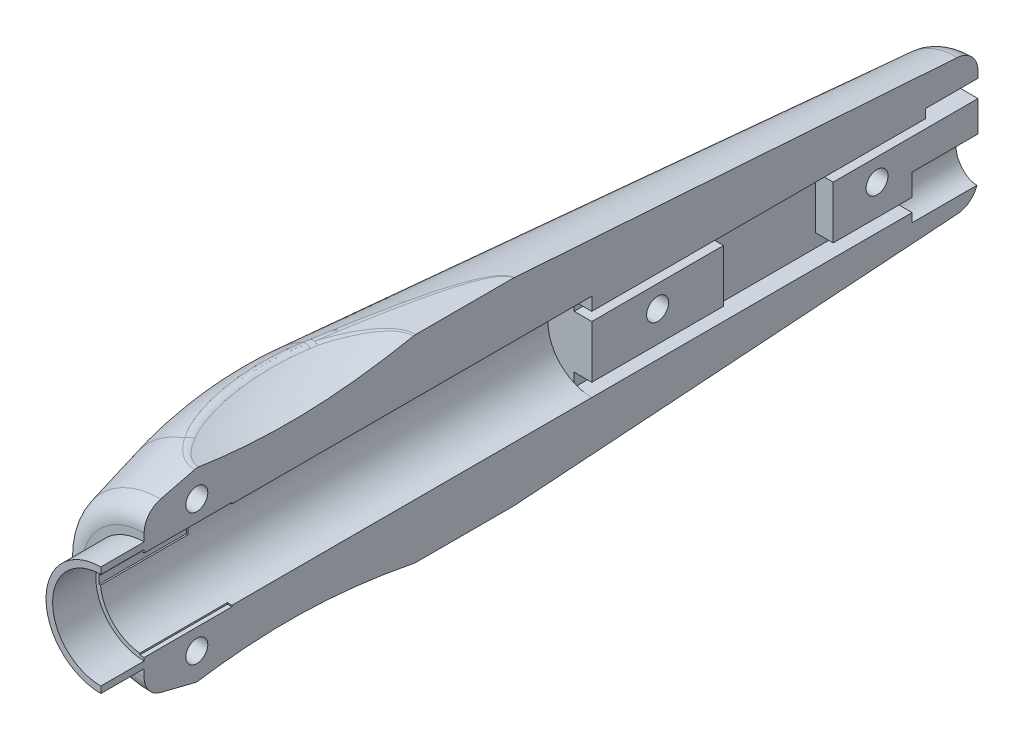
from build123d import *

# Parameters (mm, degrees)
BOSS_EXTRUDE1_DEPTH      = 51
BOSS_EXTRUDE1_DEPTH_BACK = 35
SKETCH1_R                = 11.25
SKETCH1_R_2              = 5
SKETCH2_R                = 11.25
BOSS_EXTRUDE2_DEPTH      = 9
CUT_EXTRUDE1_DEPTH       = 6
CUT_EXTRUDE2_START       = -2.5
SKETCH4_W                = 10
SKETCH4_H                = 2.5
CUT_EXTRUDE2_DEPTH       = 5
SKETCH5_R                = 2.5
CUT_EXTRUDE3_DEPTH       = 7.5
SKETCH6_W                = 1
SKETCH6_H                = 0.25
SKETCH6_W_2              = 0.25
SKETCH6_H_2              = 1
CUT_EXTRUDE4_DEPTH       = 10
SKETCH7_W                = 22.5
SKETCH7_H                = 22.5
SKETCH7_R                = 7.5
BOSS_EXTRUDE3_DEPTH      = 55
SKETCH11_R               = 6.25
SKETCH11_R_2             = 5.5
BOSS_EXTRUDE4_DEPTH      = 5
SKETCH14_W               = 14.477531198
SKETCH14_H               = 32.54061919
CUT_EXTRUDE5_DEPTH       = 30
CIRPATTERN1_COUNT        = 4
FILLET3_R                = 1.25
FILLET6_R                = 2.5
FILLET7_R                = 50
FILLET8_R                = 2.5
FILLET9_R                = 1.25
SKETCH18_R               = 5
BOSS_EXTRUDE5_DEPTH      = 35
CUT_EXTRUDE6_DEPTH       = 86
CUT_EXTRUDE6_DEPTH_BACK  = 64
SKETCH19_W               = 22.75138552
SKETCH19_H               = 48.207966269
CUT_EXTRUDE8_DEPTH       = 2
SKETCH21_R               = 1.25
CUT_EXTRUDE9_DEPTH       = 3


with BuildPart() as part:
    # Sketch1 → Boss-Extrude1 (new, two sides: drawn at the far end of the back side and taken through both)
    with BuildSketch(Plane.XY.offset(-BOSS_EXTRUDE1_DEPTH_BACK)):
        Circle(SKETCH1_R)
        Circle(SKETCH1_R_2, mode=Mode.SUBTRACT)
    extrude(amount=BOSS_EXTRUDE1_DEPTH + BOSS_EXTRUDE1_DEPTH_BACK)

    # Sketch2 → Boss-Extrude2 (add)
    with BuildSketch(Plane(origin=(0, 0, -35), x_dir=(-1, 0, 0), z_dir=(0, 0, -1))):
        with Locations(Location((0, 0, 0), (0, 0, 180))):
            Circle(SKETCH2_R)
    extrude(amount=BOSS_EXTRUDE2_DEPTH)

    # Sketch3 → Cut-Extrude1 (cut)
    with BuildSketch(Plane(origin=(0, 0, -44), x_dir=(-1, 0, 0), z_dir=(0, 0, -1))):
        Polygon((-2, 4.5), (-3, 3.5), (-3, 2.5), (3, 2.5), (3, 3.5), (2, 4.5), align=None)
    extrude(amount=-CUT_EXTRUDE1_DEPTH, mode=Mode.SUBTRACT)

    # Sketch4 → Cut-Extrude2 (cut)
    with BuildSketch(Plane(origin=(0, 0, -44), x_dir=(-1, 0, 0), z_dir=(0, 0, -1)).offset(CUT_EXTRUDE2_START)):
        with Locations((0, -2.25)):
            Rectangle(SKETCH4_W, SKETCH4_H)
    extrude(amount=-CUT_EXTRUDE2_DEPTH, mode=Mode.SUBTRACT)

    # Sketch5 → Cut-Extrude3 (cut)
    with BuildSketch(Plane(origin=(0, 0, -44), x_dir=(-1, 0, 0), z_dir=(0, 0, -1))):
        with Locations((0, -3.5)):
            Circle(SKETCH5_R)
    extrude(amount=-CUT_EXTRUDE3_DEPTH, mode=Mode.SUBTRACT)

    # Sketch6 → Cut-Extrude4 (cut)
    with BuildSketch(Plane.XY.offset(51)):
        with Locations((0, 5.025)):
            Rectangle(SKETCH6_W, SKETCH6_H)
        with Locations((-5.025, 0)):
            Rectangle(SKETCH6_W_2, SKETCH6_H_2)
        with Locations((5.025, 0)):
            Rectangle(SKETCH6_W_2, SKETCH6_H_2)
        with Locations((0, -5.025)):
            Rectangle(SKETCH6_W, SKETCH6_H)
    extrude(amount=-CUT_EXTRUDE4_DEPTH, mode=Mode.SUBTRACT)

    # Sketch7 → Boss-Extrude3 (add)
    with BuildSketch(Plane.XY.offset(51)):
        Rectangle(SKETCH7_W, SKETCH7_H)
        Circle(SKETCH7_R, mode=Mode.SUBTRACT)
    extrude(amount=-BOSS_EXTRUDE3_DEPTH)

    # Sketch11 → Boss-Extrude4 (add)
    with BuildSketch(Plane.XY.offset(51)):
        Circle(SKETCH11_R)
        Circle(SKETCH11_R_2, mode=Mode.SUBTRACT)
    extrude(amount=BOSS_EXTRUDE4_DEPTH)

    # Sketch14 → Cut-Extrude5 (cut)
    with BuildSketch(Plane(origin=(11.25, 0, 0), x_dir=(0, 0, -1), z_dir=(1, 0, 0))):
        with Locations((-63.170516655, 2.469298546)):
            Rectangle(SKETCH14_W, SKETCH14_H)
    extrude(amount=-CUT_EXTRUDE5_DEPTH, mode=Mode.SUBTRACT)

    # Sketch15 → Cut-Revolve2 (revolve, cut)
    with BuildSketch(Plane(origin=(0, 0, 0), x_dir=(1, 0, 0), z_dir=(0, 1, 0)), mode=Mode.PRIVATE) as cut_revolve2_sk:
        Polygon((-7.5, 44.75), (-13.076663252, -35), (-6.824833551, -60), (-14.824833551, -60), (-52.5, -598.779981552), (-52.5, 44.75), align=None)
    revolve(cut_revolve2_sk.sketch.rotate(Axis((0, 0, 0), (0, 0, -1)), 30.648456369), axis=Axis((0, 0, 0), (0, 0, -1)), mode=Mode.SUBTRACT)

    # Sketch17 → Cut-Revolve3 (revolve, cut)
    with BuildSketch(Plane(origin=(0, 22.25, 0), x_dir=(1, 0, 0), z_dir=(0, 1, 0))):
        with BuildLine():
            Line((0, 10), (0, -79))
            add(Edge.make_bspline(
                [(0, 10), (-6.837392998, -3.583326361), (-18.162607002, -34.5), (-6.837392998, -65.416673639), (0, -79)],
                knots=[0, 0, 0, 0, 0.5, 1, 1, 1, 1], degree=3))
        make_face()
    cut_revolve3 = revolve(axis=Axis((0, 22.25, -10), (0, 0, 1)), mode=Mode.SUBTRACT)

    # CirPattern1: Cut-Revolve3 ×4 about axis
    cirpattern1_axis = Axis((0, 0, 56), (0, 0, -1))
    for i in range(1, CIRPATTERN1_COUNT):
        add(cut_revolve3.rotate(cirpattern1_axis, i * 360 / CIRPATTERN1_COUNT), mode=Mode.SUBTRACT)

    # Fillet3
    fillet3_edges = [part.edges().sort_by_distance(p)[0] for p in [
        (0, -11.25, 20.173816154),
        (11.25, 0, 20.173816154),
        (0, 11.25, 20.173816154),
        (-11.25, 0, 20.173816154),
    ]]
    fillet(fillet3_edges, radius=FILLET3_R)

    # Fillet6
    # the kernel refuses this fillet: 2.5 mm, written as the material it takes off along each edge
    with BuildSketch(Plane(origin=(0, 0, -44), x_dir=(-0.8603112111071943, 0.5097691831047386, 0), z_dir=(0.5097691831047386, 0.8603112111071943, 0))) as fillet6_piece_1:
        with BuildLine():
            CenterArc((7.552445109 - FILLET6_R * 0.932515086138, FILLET6_R), FILLET6_R, 270, 86)
            Line((7.552445109 - FILLET6_R * 0.932515086138, 0), (7.552445109, 0))
            Line((7.552445109, 0), (7.552445109 + FILLET6_R * 0.0650489641222, FILLET6_R * 0.930243526256))
        make_face()
    revolve(axis=Axis((0, 0, -44), (0, 0, 1)), mode=Mode.SUBTRACT)

    # Fillet7
    # the kernel refuses this fillet: 50 mm, written as the material it takes off along each edge
    with BuildSketch(Plane(origin=(0, 0, 35), x_dir=(0.8319324899419933, -0.554876862176569, 0), z_dir=(0.554876862176569, 0.8319324899419933, 0))) as fillet7_piece_1:
        with BuildLine():
            CenterArc((13.076663252 - FILLET7_R * 1.00863747076, FILLET7_R * 0.088600817124), FILLET7_R, 345.959809902, 18.040190098)
            Line((13.076663252 - FILLET7_R * 0.0110734204984, FILLET7_R * 0.158357290868), (13.076663252, 0))
            Line((13.076663252, 0), (13.076663252 - FILLET7_R * 0.0385116791782, -FILLET7_R * 0.154001632392))
        make_face()
    revolve(axis=Axis((0, 0, 35), (0, 0, -1)), revolution_arc=202.595532453, mode=Mode.SUBTRACT)
    with BuildSketch(Plane(origin=(0, 0, 35), x_dir=(0.55487686217724, 0.8319324899415459, 0), z_dir=(-0.8319324899415459, 0.55487686217724, 0))) as fillet7_piece_2:
        with BuildLine():
            CenterArc((13.076663252 - FILLET7_R * 1.00863747076, FILLET7_R * 0.088600817124), FILLET7_R, 345.959809902, 18.040190098)
            Line((13.076663252 - FILLET7_R * 0.0110734204984, FILLET7_R * 0.158357290868), (13.076663252, 0))
            Line((13.076663252, 0), (13.076663252 - FILLET7_R * 0.0385116791782, -FILLET7_R * 0.154001632392))
        make_face()
    revolve(axis=Axis((0, 0, 35), (0, 0, -1)), revolution_arc=202.595532453, mode=Mode.SUBTRACT)
    with BuildSketch(Plane(origin=(0, 0, 35), x_dir=(-0.8319324899419932, 0.554876862176569, 0), z_dir=(-0.554876862176569, -0.8319324899419932, 0))) as fillet7_piece_3:
        with BuildLine():
            CenterArc((13.076663252 - FILLET7_R * 1.00863747076, FILLET7_R * 0.088600817124), FILLET7_R, 345.959809902, 18.040190098)
            Line((13.076663252 - FILLET7_R * 0.0110734204984, FILLET7_R * 0.158357290868), (13.076663252, 0))
            Line((13.076663252, 0), (13.076663252 - FILLET7_R * 0.0385116791782, -FILLET7_R * 0.154001632392))
        make_face()
    revolve(axis=Axis((0, 0, 35), (0, 0, -1)), revolution_arc=202.595532453, mode=Mode.SUBTRACT)
    with BuildSketch(Plane(origin=(0, 0, 35), x_dir=(-0.5548768621772396, -0.831932489941546, 0), z_dir=(0.831932489941546, -0.5548768621772396, 0))) as fillet7_piece_4:
        with BuildLine():
            CenterArc((13.076663252 - FILLET7_R * 1.00863747076, FILLET7_R * 0.088600817124), FILLET7_R, 345.959809902, 18.040190098)
            Line((13.076663252 - FILLET7_R * 0.0110734204984, FILLET7_R * 0.158357290868), (13.076663252, 0))
            Line((13.076663252, 0), (13.076663252 - FILLET7_R * 0.0385116791782, -FILLET7_R * 0.154001632392))
        make_face()
    revolve(axis=Axis((0, 0, 35), (0, 0, -1)), revolution_arc=202.595532453, mode=Mode.SUBTRACT)

    # Fillet8
    fillet8_edges = [part.edges().sort_by_distance(p)[0] for p in [
        (7.807747723, -4.626406267, 51),
    ]]
    fillet(fillet8_edges, radius=FILLET8_R)

    # Fillet9
    fillet9_edges = [part.edges().sort_by_distance(p)[0] for p in [
        (-6e-09, -10.573537702, 45.009571862),
        (10.573537702, -6e-09, 45.009571862),
        (6e-09, 10.573537702, 45.009571862),
        (-10.573537702, 6e-09, 45.009571862),
        (-3.19e-07, -11.225697627, 20.294796284),
        (4.90357218, -10.908383651, 38.817715229),
        (-4.903572128, -10.908383641, 38.817715401),
        (-3.687e-06, -11.25, 20.049510159),
        (5.814004695, -11.21226959, 31.784794197),
        (-5.814003157, -11.212270287, 31.784798312),
        (0.018260485, -11.25, 8.877710395),
        (5.627602002, -11.25, 28.006753099),
        (-5.627602451, -11.25, 28.006757009),
        (-0.018260485, 11.25, 8.877710395),
        (11.25, 0.018260485, 8.877710395),
        (-11.25, -0.018260485, 8.877710395),
        (-11.25, 3.687e-06, 20.049510159),
        (-11.25, 5.627602451, 28.006757009),
        (-11.25, -5.627602002, 28.006753099),
        (-11.225697627, 3.19e-07, 20.294796284),
        (-11.212270284, 5.81400314, 31.784798312),
        (-11.21226959, -5.814004696, 31.784794197),
        (-10.908383641, 4.903572128, 38.817715401),
        (-10.908383651, -4.90357218, 38.817715229),
        (11.225697627, -3.19e-07, 20.294796284),
        (10.908383651, 4.90357218, 38.817715229),
        (10.908383641, -4.903572128, 38.817715401),
        (11.25, -3.687e-06, 20.049510159),
        (11.21226959, 5.814004696, 31.784794197),
        (11.212270284, -5.81400314, 31.784798312),
        (11.25, 5.627602002, 28.006753099),
        (11.25, -5.627602451, 28.006757009),
        (3.19e-07, 11.225697627, 20.294796284),
        (-4.90357218, 10.908383651, 38.817715229),
        (4.903572128, 10.908383641, 38.817715401),
        (3.687e-06, 11.25, 20.049510159),
        (-5.814004696, 11.21226959, 31.784794197),
        (5.81400314, 11.212270284, 31.784798312),
        (-5.627602002, 11.25, 28.006753099),
        (5.627602451, 11.25, 28.006757009),
    ]]
    fillet(fillet9_edges, radius=FILLET9_R)

    # Sketch18 → Boss-Extrude5 (add)
    with BuildSketch(Plane.XY.offset(-35)):
        Circle(SKETCH18_R)
    extrude(amount=BOSS_EXTRUDE5_DEPTH)

    # Sketch19 → Cut-Extrude6 (cut, two sides: drawn at the far end of the back side and taken through both)
    with BuildSketch(Plane.XY.offset(-CUT_EXTRUDE6_DEPTH_BACK)):
        with Locations((11.37569276, -1.630053536)):
            Rectangle(SKETCH19_W, SKETCH19_H)
    extrude(amount=CUT_EXTRUDE6_DEPTH + CUT_EXTRUDE6_DEPTH_BACK, mode=Mode.SUBTRACT)

    # Sketch20 → Cut-Extrude8 (cut)
    with BuildSketch(Plane(origin=(0, 0, 0), x_dir=(0, 0, -1), z_dir=(1, 0, 0))):
        Polygon((0, 3.5), (38, 3.5), (38, 2.5), (27.5, 2.5), (27.5, -3.5), (36.5, -3.5), (36.5, -5), (0, -5), (0, -3.5), (15, -3.5), (15, 2.5), (0, 2.5), align=None)
    extrude(amount=-CUT_EXTRUDE8_DEPTH, mode=Mode.SUBTRACT)

    # Sketch21 → Cut-Extrude9 (cut)
    with BuildSketch(Plane(origin=(0, 0, 0), x_dir=(0, 0, -1), z_dir=(1, 0, 0))):
        with Locations(Location((7.5, 0, 0), (0, 0, 90))):
            Circle(SKETCH21_R)
        with Locations(Location((32.5, 0, 0), (0, 0, 90))):
            Circle(SKETCH21_R)
        with Locations(Location((-45, 7.5, 0), (0, 0, 90))):
            Circle(SKETCH21_R)
        with Locations(Location((-45, -7.5, 0), (0, 0, 90))):
            Circle(SKETCH21_R)
    extrude(amount=-CUT_EXTRUDE9_DEPTH, mode=Mode.SUBTRACT)


solid = part.part
